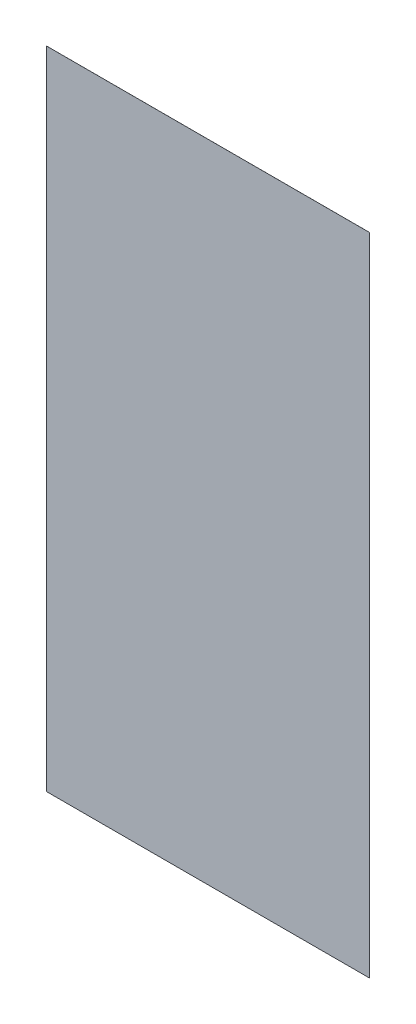
from build123d import *

# Parameters (mm, degrees)
SKETCH_1_W      = 100
SKETCH_1_H      = 200
EXTRUDE_1_DEPTH = 0.01


with BuildPart() as part:
    # 草图1 → 凸台-拉伸1 (new body)
    with BuildSketch(Plane.XY):
        Rectangle(SKETCH_1_W, SKETCH_1_H)
    extrude(amount=EXTRUDE_1_DEPTH)


solid = part.part
